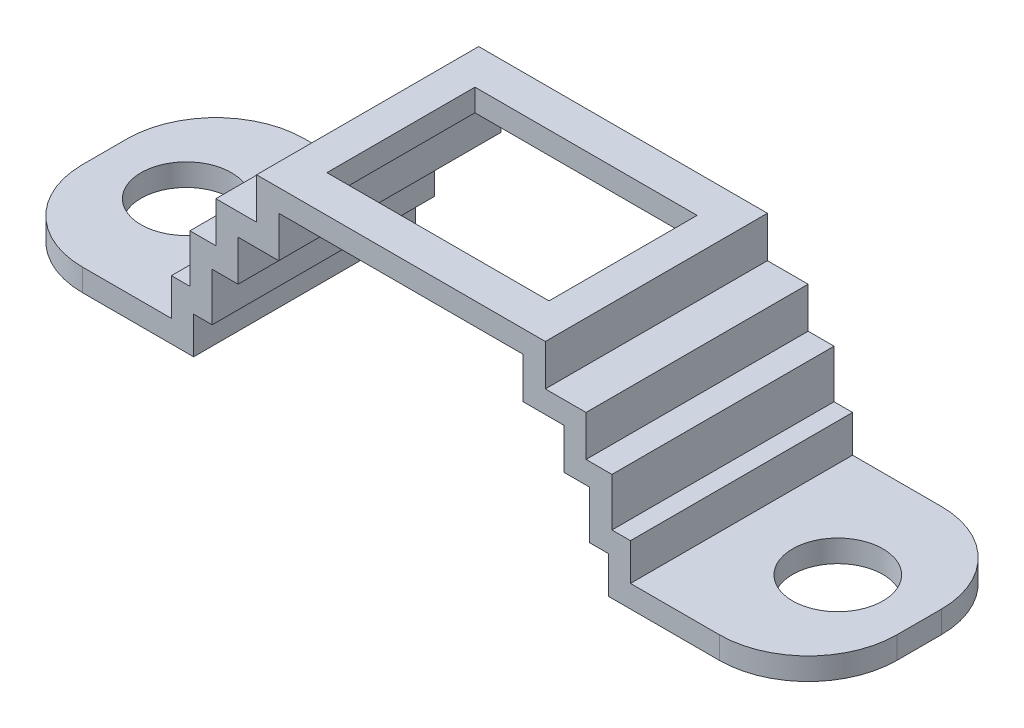
from build123d import *

# Parameters (mm, degrees)
EXTRUDE_THIN1_DEPTH  = 15
SKETCH2_R            = 6.1
CUT_EXTRUDE1_DEPTH   = 62.306626885
FILLET1_R            = 12
FILLET1_OF_MIRROR1_R = 12
SKETCH3_W            = 30
SKETCH3_H            = 20
CUT_EXTRUDE2_DEPTH   = 63.472413912


with BuildPart() as part:
    # Sketch1 → Extrude-Thin1 (new, symmetric)
    with BuildSketch(Plane.XY):
        Polygon((-55, 4.5), (-28, 4.5), (-28, 9.5), (-25.5, 9.5), (-25.5, 16), (-22, 16), (-22, 21.5), (-16.5, 21.5), (-16.5, 27.05), (0, 27.05), (0, 30.05), (-19.5, 30.05), (-19.5, 24.5), (-25, 24.5), (-25, 19), (-28.5, 19), (-28.5, 12.5), (-31, 12.5), (-31, 7.5), (-55, 7.5), align=None)
    extrude_thin1 = extrude(amount=EXTRUDE_THIN1_DEPTH, both=True)

    # Sketch2 → Cut-Extrude1 (cut, through all)
    with BuildSketch(Plane(origin=(0, 7.5, 0), x_dir=(1, 0, 0), z_dir=(0, 1, 0))):
        with Locations((-44, 0)):
            Circle(SKETCH2_R)
    cut_extrude1 = extrude(amount=-CUT_EXTRUDE1_DEPTH, mode=Mode.SUBTRACT)

    # Fillet1
    fillet1_edges = [part.edges().sort_by_distance(p)[0] for p in [
        (-55, 6, -15),
        (-55, 6, 15),
    ]]
    fillet(fillet1_edges, radius=FILLET1_R)

    # Mirror1: Extrude-Thin1, Cut-Extrude1 across plane
    add(extrude_thin1.mirror(Plane(origin=(0, 30.05, 15), x_dir=(0, 0, 1), z_dir=(1, 0, 0))))
    add(cut_extrude1.mirror(Plane(origin=(0, 30.05, 15), x_dir=(0, 0, 1), z_dir=(1, 0, 0))), mode=Mode.SUBTRACT)

    # Fillet1 of Mirror1
    fillet1_of_mirror1_edges = [part.edges().sort_by_distance(p)[0] for p in [
        (55, 6, -15),
        (55, 6, 15),
    ]]
    fillet(fillet1_of_mirror1_edges, radius=FILLET1_OF_MIRROR1_R)

    # Sketch3 → Cut-Extrude2 (cut, through all)
    with BuildSketch(Plane(origin=(0, 30.05, 0), x_dir=(1, 0, 0), z_dir=(0, 1, 0))):
        Rectangle(SKETCH3_W, SKETCH3_H)
    extrude(amount=-CUT_EXTRUDE2_DEPTH, mode=Mode.SUBTRACT)


solid = part.part
